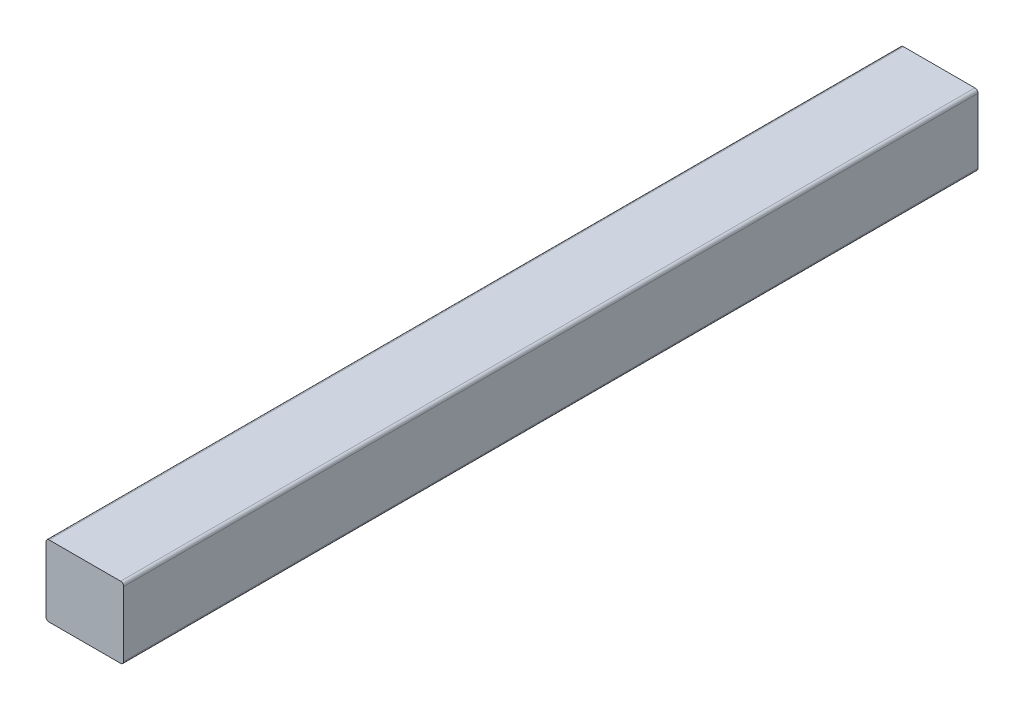
from build123d import *

# Parameters (mm, degrees)
BOSS_EXTRUDE1_DEPTH = 550


with BuildPart() as part:
    # Sketch1 → Boss-Extrude1 (new body)
    with BuildSketch(Plane.XY):
        with BuildLine():
            Line((2, 0), (48, 0))
            ThreePointArc((48, 0), (49.414213562, 0.585786438), (50, 2))
            Line((50, 2), (50, 43.82575695))
            ThreePointArc((50, 43.82575695), (49.414213562, 45.239970512), (48, 45.82575695))
            Line((48, 45.82575695), (2, 45.82575695))
            ThreePointArc((2, 45.82575695), (0.585786438, 45.239970512), (0, 43.82575695))
            Line((0, 43.82575695), (0, 2))
            ThreePointArc((0, 2), (0.585786438, 0.585786438), (2, 0))
        make_face()
    extrude(amount=BOSS_EXTRUDE1_DEPTH)


solid = part.part
